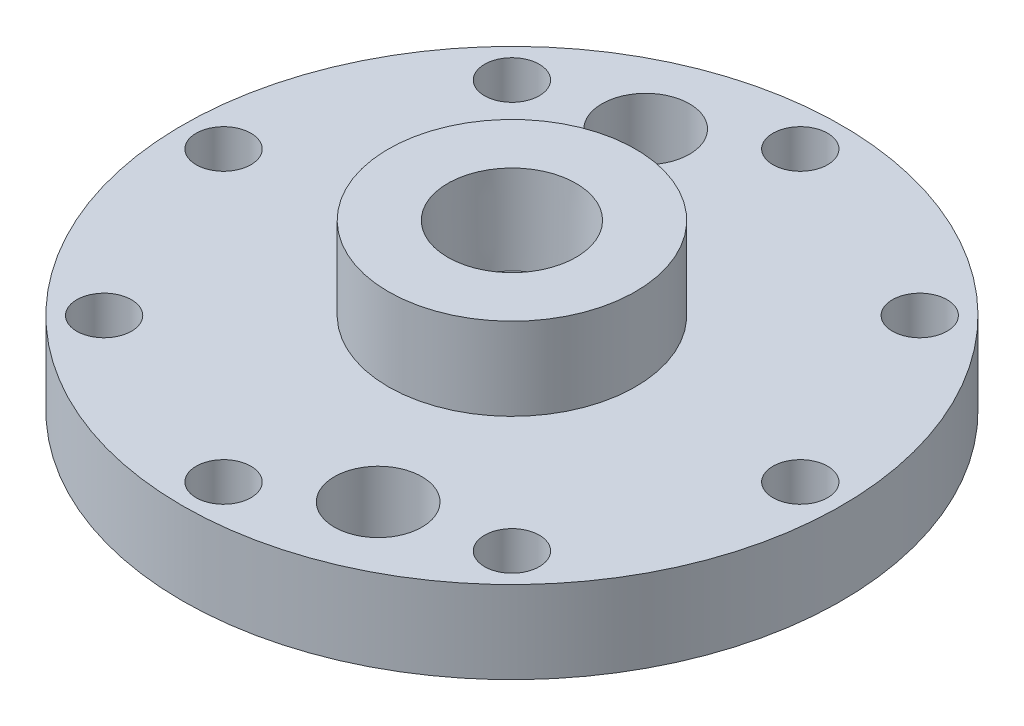
from build123d import *

# Parameters (mm, degrees)
F_5_16_CLEARANCE_HOLE1_D = 8.4328
CIRPATTERN1_COUNT        = 8
F_1_2_CLEARANCE_HOLE1_D  = 13.49248
CIRPATTERN2_COUNT        = 2


with BuildPart() as part:
    # Sketch1 → Revolve1 (revolve)
    with BuildSketch(Plane.XY):
        Polygon((-19.431, 0), (-50.8, 0), (-50.8, 12.7), (-19.05, 12.7), (-19.05, 25.4), (0, 25.4), (0, 0), (-15.875, 0), (-15.875, 2.54), (-19.431, 2.54), align=None)
    revolve(axis=Axis((0, 25.4, 0), (0, -1, 0)))

    # Sketch4 → 1/2 NPT Tapped Hole1 (revolve, cut)
    with BuildSketch(Plane(origin=(0, 25.4, 0), x_dir=(0, 0, 1), z_dir=(1, 0, 0))):
        Polygon((0, 0), (0, 25.4), (8.9281, 25.4), (8.9281, 13.462), (9.479726792, 13.462), (9.8827971, 0), align=None)
    revolve(axis=Axis((0, 31.75, 0), (0, -1, 0)), mode=Mode.SUBTRACT)

    # 5/16 Clearance Hole1 (through all)
    with Locations(Plane(origin=(0, 12.7, 0), x_dir=(1, 0, 0), z_dir=(0, 1, 0))):
        with Locations((44.45, 0)):
            f_5_16_clearance_hole1 = Hole(F_5_16_CLEARANCE_HOLE1_D / 2)

    # CirPattern1: 5/16 Clearance Hole1 ×8 about axis
    cirpattern1_axis = Axis((0, 25.4, 0), (0, 1, 0))
    for i in range(1, CIRPATTERN1_COUNT):
        add(f_5_16_clearance_hole1.rotate(cirpattern1_axis, i * 360 / CIRPATTERN1_COUNT), mode=Mode.SUBTRACT)

    # 1/2 Clearance Hole1 (through all)
    with Locations(Plane(origin=(0, 12.7, 0), x_dir=(1, 0, 0), z_dir=(0, 1, 0))):
        with Locations((-14.580238773, 35.199810189)):
            f_1_2_clearance_hole1 = Hole(F_1_2_CLEARANCE_HOLE1_D / 2)

    # CirPattern2: 1/2 Clearance Hole1 ×2 about axis
    cirpattern2_axis = Axis((0, 25.4, 0), (0, 1, 0))
    for i in range(1, CIRPATTERN2_COUNT):
        add(f_1_2_clearance_hole1.rotate(cirpattern2_axis, i * 360 / CIRPATTERN2_COUNT), mode=Mode.SUBTRACT)


solid = part.part
